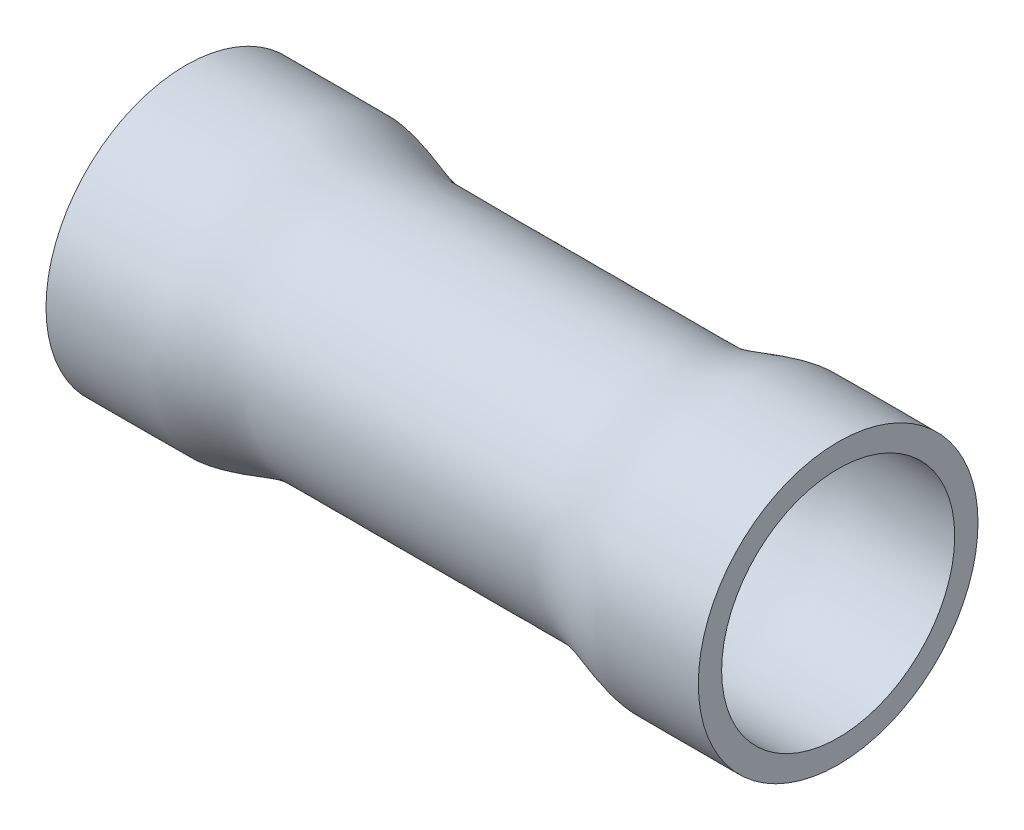
from build123d import *

# Parameters (mm, degrees)
BOSS_EXTRUDE1_DEPTH      = 3
BOSS_EXTRUDE1_DEPTH_BACK = 3
FILTERSKETCH_R           = 2
FILTERSKETCH_R_2         = 1.5


with BuildPart() as part:
    # FilterSketch → Boss-Extrude1 (new, two sides: drawn at the far end of the back side and taken through both)
    with BuildSketch(Plane(origin=(0, 0, 0), x_dir=(0, 0, -1), z_dir=(1, 0, 0)).offset(-BOSS_EXTRUDE1_DEPTH_BACK)):
        Circle(FILTERSKETCH_R)
        Circle(FILTERSKETCH_R_2, mode=Mode.SUBTRACT)
    extrude(amount=BOSS_EXTRUDE1_DEPTH + BOSS_EXTRUDE1_DEPTH_BACK)


with BuildPart() as body_2:
    # Sketch2 → Revolve1 (revolve)
    with BuildSketch(Plane.XY):
        with BuildLine():
            Line((-7, 3.001192), (-7, 2.501192))
            add(Edge.make_bspline(
                [(-7, 2.501192), (-6.475, 2.501192), (-5.95, 2.501192), (-5.425, 2.501192), (-5.365363155, 2.501192), (-5.246089464, 2.501192), (-5.067178927, 2.501192), (-4.947905237, 2.501192), (-4.888268391, 2.501192), (-4.854770001, 2.501192), (-4.787773222, 2.501192), (-4.686904885, 2.492442128), (-4.620908847, 2.480905603), (-4.587910828, 2.475137341), (-4.56797972, 2.471653257), (-4.528117503, 2.464685089), (-4.468698077, 2.452076922), (-4.429224398, 2.443158481), (-4.409533283, 2.43850575), (-4.091175181, 2.36328225), (-3.786601389, 2.23790975), (-3.475081265, 2.16268625), (-3.456111714, 2.158105628), (-3.418084915, 2.149307553), (-3.36084555, 2.136832466), (-3.322443067, 2.129864454), (-3.303241825, 2.126380447), (-3.271063114, 2.120541719), (-3.206705692, 2.108864262), (-3.108201618, 2.1), (-3.042793355, 2.1), (-3.010089224, 2.1), (-2.955723855, 2.1), (-2.846993117, 2.1), (-2.68389701, 2.1), (-2.575166272, 2.1), (-2.520800903, 2.1), (-0.840266968, 2.1), (0.840266968, 2.1), (2.520800903, 2.1), (2.575166272, 2.1), (2.68389701, 2.1), (2.846993117, 2.1), (2.955723855, 2.1), (3.010089224, 2.1), (3.042793355, 2.1), (3.108201618, 2.1), (3.206705692, 2.108864262), (3.271063114, 2.120541719), (3.303241825, 2.126380447), (3.322443067, 2.129864454), (3.36084555, 2.136832466), (3.418084915, 2.149307553), (3.456111714, 2.158105628), (3.475081265, 2.16268625), (3.786601389, 2.23790975), (4.091175181, 2.36328225), (4.409533283, 2.43850575), (4.429224398, 2.443158481), (4.468698077, 2.452076922), (4.528117503, 2.464685089), (4.56797972, 2.471653257), (4.587910828, 2.475137341), (4.620908847, 2.480905603), (4.686904885, 2.492442128), (4.787773222, 2.501192), (4.854770001, 2.501192), (4.888268391, 2.501192), (4.947905237, 2.501192), (5.067178927, 2.501192), (5.246089464, 2.501192), (5.365363155, 2.501192), (5.425, 2.501192), (5.95, 2.501192), (6.475, 2.501192), (7, 2.501192)],
                knots=[0, 0, 0, 0, 0.110464725, 0.110464725, 0.110464725, 0.123012855, 0.135560984, 0.148109113, 0.148109113, 0.148109113, 0.155157475, 0.162205838, 0.169254201, 0.169254201, 0.169254201, 0.173511477, 0.177768753, 0.182026029, 0.182026029, 0.182026029, 0.250855974, 0.250855974, 0.250855974, 0.255047271, 0.259238567, 0.263429864, 0.263429864, 0.263429864, 0.270453915, 0.277477967, 0.284502019, 0.284502019, 0.284502019, 0.296178378, 0.307854737, 0.319531095, 0.319531095, 0.319531095, 0.680468905, 0.680468905, 0.680468905, 0.692145263, 0.703821622, 0.715497981, 0.715497981, 0.715497981, 0.722522033, 0.729546085, 0.736570136, 0.736570136, 0.736570136, 0.740761433, 0.744952729, 0.749144026, 0.749144026, 0.749144026, 0.817973971, 0.817973971, 0.817973971, 0.822231247, 0.826488523, 0.830745799, 0.830745799, 0.830745799, 0.837794162, 0.844842525, 0.851890887, 0.851890887, 0.851890887, 0.864439016, 0.876987145, 0.889535275, 0.889535275, 0.889535275, 1, 1, 1, 1], degree=3))
            Line((7, 2.501192), (7, 3.001192))
            add(Edge.make_bspline(
                [(-7, 3.001192), (-6.475, 3.001192), (-5.95, 3.001192), (-5.425, 3.001192), (-5.365363155, 3.001192), (-5.246089464, 3.001192), (-5.067178927, 3.001192), (-4.947905237, 3.001192), (-4.888268391, 3.001192), (-4.854770001, 3.001192), (-4.787773222, 3.001192), (-4.686904885, 2.992442128), (-4.620908847, 2.980905603), (-4.587910828, 2.975137341), (-4.56797972, 2.971653257), (-4.528117503, 2.964685089), (-4.468698077, 2.952076922), (-4.429224398, 2.943158481), (-4.409533283, 2.93850575), (-4.091175181, 2.86328225), (-3.786601389, 2.73790975), (-3.475081265, 2.66268625), (-3.456111714, 2.658105628), (-3.418084915, 2.649307553), (-3.36084555, 2.636832466), (-3.322443067, 2.629864454), (-3.303241825, 2.626380447), (-3.271063114, 2.620541719), (-3.206705692, 2.608864262), (-3.108201618, 2.6), (-3.042793355, 2.6), (-3.010089224, 2.6), (-2.955723855, 2.6), (-2.846993117, 2.6), (-2.68389701, 2.6), (-2.575166272, 2.6), (-2.520800903, 2.6), (-0.840266968, 2.6), (0.840266968, 2.6), (2.520800903, 2.6), (2.575166272, 2.6), (2.68389701, 2.6), (2.846993117, 2.6), (2.955723855, 2.6), (3.010089224, 2.6), (3.042793355, 2.6), (3.108201618, 2.6), (3.206705692, 2.608864262), (3.271063114, 2.620541719), (3.303241825, 2.626380447), (3.322443067, 2.629864454), (3.36084555, 2.636832466), (3.418084915, 2.649307553), (3.456111714, 2.658105628), (3.475081265, 2.66268625), (3.786601389, 2.73790975), (4.091175181, 2.86328225), (4.409533283, 2.93850575), (4.429224398, 2.943158481), (4.468698077, 2.952076922), (4.528117503, 2.964685089), (4.56797972, 2.971653257), (4.587910828, 2.975137341), (4.620908847, 2.980905603), (4.686904885, 2.992442128), (4.787773222, 3.001192), (4.854770001, 3.001192), (4.888268391, 3.001192), (4.947905237, 3.001192), (5.067178927, 3.001192), (5.246089464, 3.001192), (5.365363155, 3.001192), (5.425, 3.001192), (5.95, 3.001192), (6.475, 3.001192), (7, 3.001192)],
                knots=[0, 0, 0, 0, 0.110464725, 0.110464725, 0.110464725, 0.123012855, 0.135560984, 0.148109113, 0.148109113, 0.148109113, 0.155157475, 0.162205838, 0.169254201, 0.169254201, 0.169254201, 0.173511477, 0.177768753, 0.182026029, 0.182026029, 0.182026029, 0.250855974, 0.250855974, 0.250855974, 0.255047271, 0.259238567, 0.263429864, 0.263429864, 0.263429864, 0.270453915, 0.277477967, 0.284502019, 0.284502019, 0.284502019, 0.296178378, 0.307854737, 0.319531095, 0.319531095, 0.319531095, 0.680468905, 0.680468905, 0.680468905, 0.692145263, 0.703821622, 0.715497981, 0.715497981, 0.715497981, 0.722522033, 0.729546085, 0.736570136, 0.736570136, 0.736570136, 0.740761433, 0.744952729, 0.749144026, 0.749144026, 0.749144026, 0.817973971, 0.817973971, 0.817973971, 0.822231247, 0.826488523, 0.830745799, 0.830745799, 0.830745799, 0.837794162, 0.844842525, 0.851890887, 0.851890887, 0.851890887, 0.864439016, 0.876987145, 0.889535275, 0.889535275, 0.889535275, 1, 1, 1, 1], degree=3))
        make_face()
    revolve(axis=Axis((-12.5, 0, 0), (1, 0, 0)))


solid = Compound([part.part, body_2.part])
